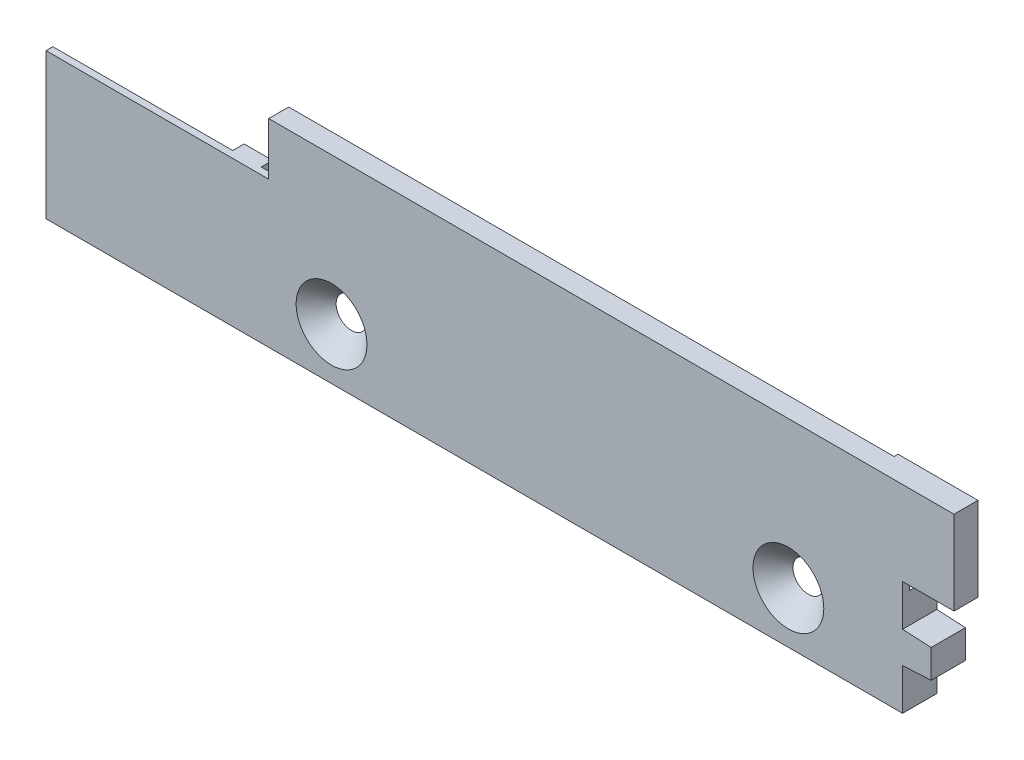
from build123d import *
from OCP.BRepFilletAPI import BRepFilletAPI_MakeChamfer

# Parameters (mm, degrees)
BOSS_EXTRUDE1_DEPTH      = 6
BOSS_EXTRUDE1_DEPTH_BACK = 6
CUT_EXTRUDE1_DEPTH       = 157
CUT_EXTRUDE4_DEPTH       = 2.5
CUT_EXTRUDE4_DEPTH_BACK  = 2.5
SKETCH8_W                = 125
SKETCH8_H                = 34.7
CUT_EXTRUDE5_DEPTH       = 131.348014108
CUT_EXTRUDE5_DEPTH_BACK  = 131.348014108
SKETCH9_R                = 2.7
CHAMFER2_SIZE            = 5
CHAMFER2_SIZE_2          = 0.262038896
CUT_EXTRUDE8_DEPTH       = 10
CUT_EXTRUDE9_DEPTH       = 131.715773363
SKETCH16_W               = 214.344642296
SKETCH16_H               = 84.645654919
CUT_EXTRUDE10_DEPTH      = 131.348014108
SKETCH17_W               = 2
SKETCH17_H               = 14.7
CUT_EXTRUDE11_DEPTH      = 1.8
SKETCH18_R               = 1.35
CUT_EXTRUDE12_DEPTH      = 3
CHAMFER7_SIZE            = 3.5
SKETCH19_W               = 5
SKETCH19_H               = 7.5
BOSS_EXTRUDE2_DEPTH      = 2


with BuildPart() as part:
    # Sketch1 → Boss-Extrude1 (new, two sides: drawn at the far end of the back side and taken through both)
    with BuildSketch(Plane.XY.offset(-BOSS_EXTRUDE1_DEPTH_BACK)):
        Polygon((-127.819104229, -9.862903226), (22.180895771, -9.862903226), (22.180895771, -2.612903226), (27.180895771, -2.612903226), (27.180895771, 2.887096774), (22.180895771, 2.887096774), (22.180895771, 10.137096774), (31.180895771, 10.137096774), (31.180895771, 23.637096774), (31.180895771, 24.837096774), (-88.819104229, 24.837096774), (-88.819104229, 23.637096774), (-88.819104229, 15.637096774), (-127.819104229, 15.637096774), align=None)
    extrude(amount=BOSS_EXTRUDE1_DEPTH + BOSS_EXTRUDE1_DEPTH_BACK)

    # Sketch2 → Cut-Extrude1 (cut)
    with BuildSketch(Plane.ZY.offset(127.819104229)):
        Polygon((-4.8, 23.137096774), (-4.8, 8.137096774), (4.8, 8.137096774), (4.8, 23.137096774), (1.8, 23.137096774), (1.8, 24.837096774), (-1.8, 24.837096774), (-1.8, 23.137096774), align=None)
    extrude(amount=-CUT_EXTRUDE1_DEPTH, mode=Mode.SUBTRACT)

    # Sketch8 → Cut-Extrude4 (cut, two sides: drawn at the far end of the back side and taken through both)
    with BuildSketch(Plane.XY.offset(-CUT_EXTRUDE4_DEPTH_BACK)):
        with Locations((-45.319104229, 7.487096774)):
            Rectangle(SKETCH8_W, SKETCH8_H)
    extrude(amount=CUT_EXTRUDE4_DEPTH + CUT_EXTRUDE4_DEPTH_BACK, mode=Mode.SUBTRACT)

    # Sketch9 → Cut-Extrude5 (cut, two sides: drawn at the far end of the back side and taken through both)
    with BuildSketch(Plane.XY.offset(-CUT_EXTRUDE5_DEPTH_BACK)):
        with Locations((-77.819104229, -0.862903226)):
            Circle(SKETCH9_R)
        with Locations((2.180895771, -0.862903226)):
            Circle(SKETCH9_R)
    extrude(amount=CUT_EXTRUDE5_DEPTH + CUT_EXTRUDE5_DEPTH_BACK, mode=Mode.SUBTRACT)

    # Chamfer2
    chamfer2_edges_1 = [part.edges().sort_by_distance(p)[0] for p in [
        (27.180895771, -2.612903226, 0),
    ]]
    chamfer2_side_1 = [part.faces().sort_by_distance(p)[0] for p in [
        (27.175654993, -2.612903226, 0),
    ]]
    chamfer2_edges_2 = [part.edges().sort_by_distance(p)[0] for p in [
        (27.180895771, 2.887096774, 0),
    ]]
    chamfer2_side_2 = [part.faces().sort_by_distance(p)[0] for p in [
        (27.180895771, 2.881855996, 0),
    ]]
    chamfer2 = BRepFilletAPI_MakeChamfer(part.part.solid().wrapped)
    for e in chamfer2_edges_1:
        chamfer2.Add(CHAMFER2_SIZE - 0.0001, CHAMFER2_SIZE_2 - 0.0001, e.wrapped, chamfer2_side_1[0].wrapped)
    for e in chamfer2_edges_2:
        chamfer2.Add(CHAMFER2_SIZE_2 - 0.0001, CHAMFER2_SIZE - 0.0001, e.wrapped, chamfer2_side_2[0].wrapped)
    add(Compound.cast(chamfer2.Shape()), mode=Mode.REPLACE)  # a hair under: the kernel refuses the full size

    # Sketch14 → Cut-Extrude8 (cut)
    with BuildSketch(Plane(origin=(0, 8.137096774, 0), x_dir=(1, 0, 0), z_dir=(0, 1, 0))):
        with BuildLine():
            Line((-120.319104229, 4.5), (-115.319104229, 4.5))
            ThreePointArc((-115.319104229, 4.5), (-110.819104229, 0), (-115.319104229, -4.5))
            Line((-115.319104229, -4.5), (-120.319104229, -4.5))
            ThreePointArc((-120.319104229, -4.5), (-124.819104229, 0), (-120.319104229, 4.5))
        make_face()
    extrude(amount=-CUT_EXTRUDE8_DEPTH, mode=Mode.SUBTRACT)

    # Sketch15 → Cut-Extrude9 (cut, through all)
    with BuildSketch(Plane(origin=(0, -1.862903226, 0), x_dir=(1, 0, 0), z_dir=(0, 1, 0))):
        with BuildLine():
            Line((-120.319104229, -2.6), (-115.319104229, -2.6))
            ThreePointArc((-115.319104229, -2.6), (-112.719104229, 0), (-115.319104229, 2.6))
            Line((-115.319104229, 2.6), (-120.319104229, 2.6))
            ThreePointArc((-120.319104229, 2.6), (-122.919104229, 0), (-120.319104229, -2.6))
        make_face()
    extrude(amount=-CUT_EXTRUDE9_DEPTH, mode=Mode.SUBTRACT)

    # Sketch16 → Cut-Extrude10 (cut, through all)
    with BuildSketch(Plane.XY):
        with Locations((-30.272765953, 16.776086779)):
            Rectangle(SKETCH16_W, SKETCH16_H)
    extrude(amount=-CUT_EXTRUDE10_DEPTH, mode=Mode.SUBTRACT)

    # Sketch17 → Cut-Extrude11 (cut)
    with BuildSketch(Plane(origin=(0, 0, 0), x_dir=(-1, 0, 0), z_dir=(0, 0, -1))):
        with Locations((-30.180895771, 17.487096774)):
            Rectangle(SKETCH17_W, SKETCH17_H)
    extrude(amount=-CUT_EXTRUDE11_DEPTH, mode=Mode.SUBTRACT)

    # Sketch18 → Cut-Extrude12 (cut)
    with BuildSketch(Plane(origin=(0, 0, 0), x_dir=(-1, 0, 0), z_dir=(0, 0, -1))):
        with Locations((110.319104229, -5.862903226)):
            Circle(SKETCH18_R)
        with Locations((125.319104229, -5.862903226)):
            Circle(SKETCH18_R)
        with Locations((-22.180895771, 0.137096774)):
            Circle(SKETCH18_R)
    extrude(amount=-CUT_EXTRUDE12_DEPTH, mode=Mode.SUBTRACT)

    # Chamfer7
    chamfer7_edges = [part.edges().sort_by_distance(p)[0] for p in [
        (-80.519104229, -0.862903226, 6),
        (-0.519104229, -0.862903226, 6),
    ]]
    chamfer(chamfer7_edges, length=CHAMFER7_SIZE - 0.0001)  # a hair under: the kernel refuses the full size

    # Sketch19 → Boss-Extrude2 (add)
    with BuildSketch(Plane(origin=(0, 0, 4.8), x_dir=(-1, 0, 0), z_dir=(0, 0, -1))):
        with Locations((93.819104229, 11.887096774)):
            Rectangle(SKETCH19_W, SKETCH19_H)
    extrude(amount=BOSS_EXTRUDE2_DEPTH)


solid = part.part
